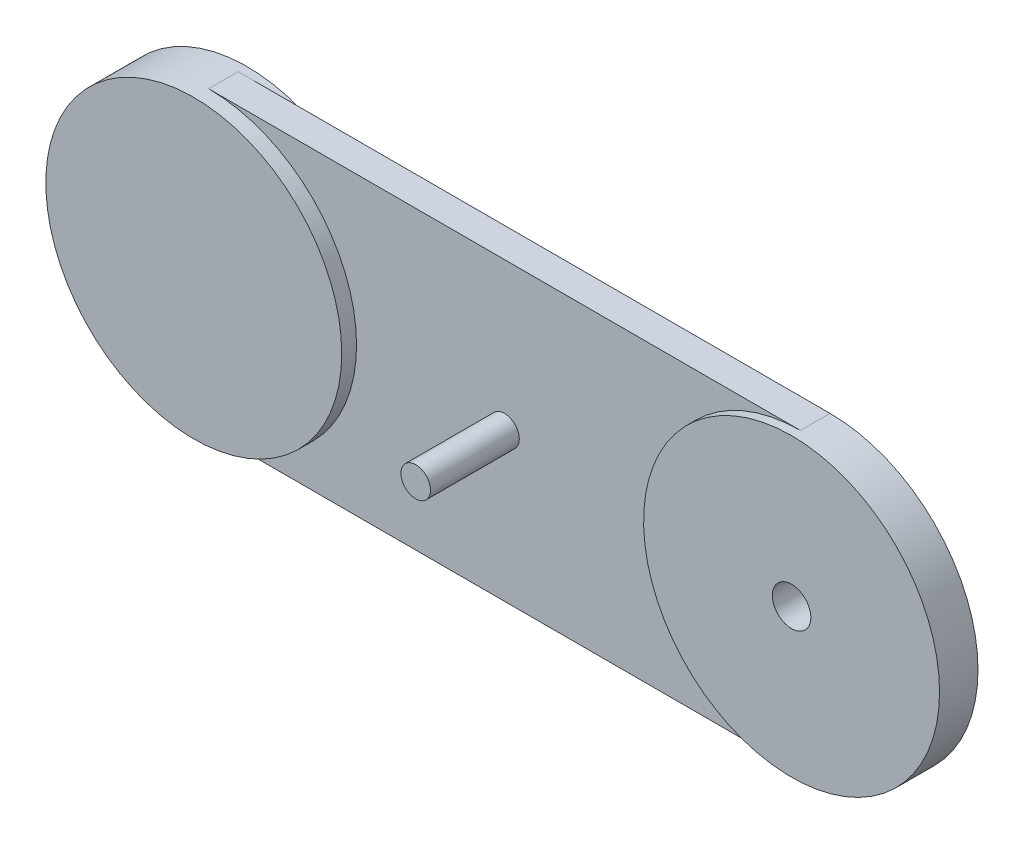
from build123d import *

# Parameters (mm, degrees)
SKETCH_1_R            = 50
EXTRUDE_18_DEPTH      = 13
EXTRUDE_18_2_DEPTH    = 13
SKETCH_1_28_W         = 200
SKETCH_1_28_H         = 100
EXTRUDE_21_DEPTH      = 10
SKETCH_1_30_R         = 5
EXTRUDE_22_DEPTH      = 40
SKETCH_1_31_R         = 50
CUT_EXTRUDE_2_DEPTH   = 41
EXTRUDE_23_DEPTH      = 15
EXTRUDE_23_DEPTH_BACK = 3
SKETCH_1_32_R         = 50
SKETCH_1_33_R         = 6.5
CUT_EXTRUDE_3_DEPTH   = 242.8


with BuildPart() as part:
    # 草图1 → 凸台-拉伸18 (new body)
    with BuildSketch(Plane.XY):
        with Locations((0, 50)):
            Circle(SKETCH_1_R)
    extrude(amount=EXTRUDE_18_DEPTH)



with BuildPart() as body_2:
    # 草图1 → Extrude 18 2 (new body)
    with BuildSketch(Plane.XY):
        with Locations((-200, 50)):
            Circle(SKETCH_1_R)
    extrude(amount=EXTRUDE_18_2_DEPTH)


with BuildPart() as part_1:
    add(part.part)

    add(body_2.part)  # 凸台-拉伸21 merges body 2
    # 草图1<28> → 凸台-拉伸21 (add)
    with BuildSketch(Plane.XY):
        with Locations((-100, 50)):
            Rectangle(SKETCH_1_28_W, SKETCH_1_28_H)
    extrude(amount=EXTRUDE_21_DEPTH)

    # 草图1<30> → 凸台-拉伸22 (add)
    with BuildSketch(Plane.XY):
        with Locations((-100, 50)):
            Circle(SKETCH_1_30_R)
    extrude(amount=EXTRUDE_22_DEPTH)

    # 草图1<31> → 切除-拉伸2 (cut)
    with BuildSketch(Plane.XY):
        with Locations((-200, 50)):
            Circle(SKETCH_1_31_R)
    extrude(amount=CUT_EXTRUDE_2_DEPTH, mode=Mode.SUBTRACT)

    # 草图1<32> → 凸台-拉伸23 (add, two sides: drawn at the far end of the back side and taken through both)
    with BuildSketch(Plane.XY.offset(-EXTRUDE_23_DEPTH_BACK)):
        with Locations((-200, 50)):
            Circle(SKETCH_1_32_R)
    extrude(amount=EXTRUDE_23_DEPTH + EXTRUDE_23_DEPTH_BACK)

    # 草图1<33> → 切除-拉伸3 (cut)
    with BuildSketch(Plane.XY):
        with Locations((0, 50)):
            Circle(SKETCH_1_33_R)
    extrude(amount=CUT_EXTRUDE_3_DEPTH, mode=Mode.SUBTRACT)


solid = part_1.part
